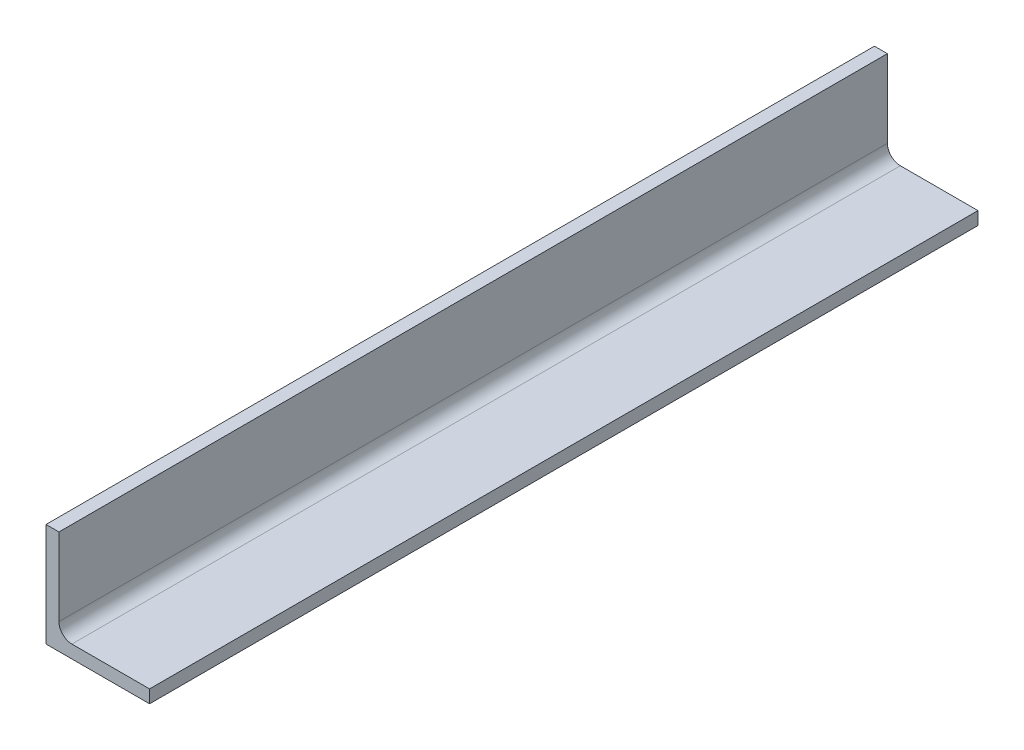
from build123d import *

# Parameters (mm, degrees)
BOSS_EXTRUDE1_DEPTH = 203.2


with BuildPart() as part:
    # Sketch2 → Boss-Extrude1 (new, symmetric)
    with BuildSketch(Plane.XY):
        with BuildLine():
            Line((0, 0), (0, 50.8))
            Line((0, 50.8), (6.35, 50.8))
            Line((6.35, 50.8), (6.35, 12.7))
            ThreePointArc((6.35, 12.7), (8.209871939, 8.209871939), (12.7, 6.35))
            Line((12.7, 6.35), (50.8, 6.35))
            Line((50.8, 6.35), (50.8, 0))
            Line((50.8, 0), (0, 0))
        make_face()
    extrude(amount=BOSS_EXTRUDE1_DEPTH, both=True)


solid = part.part
